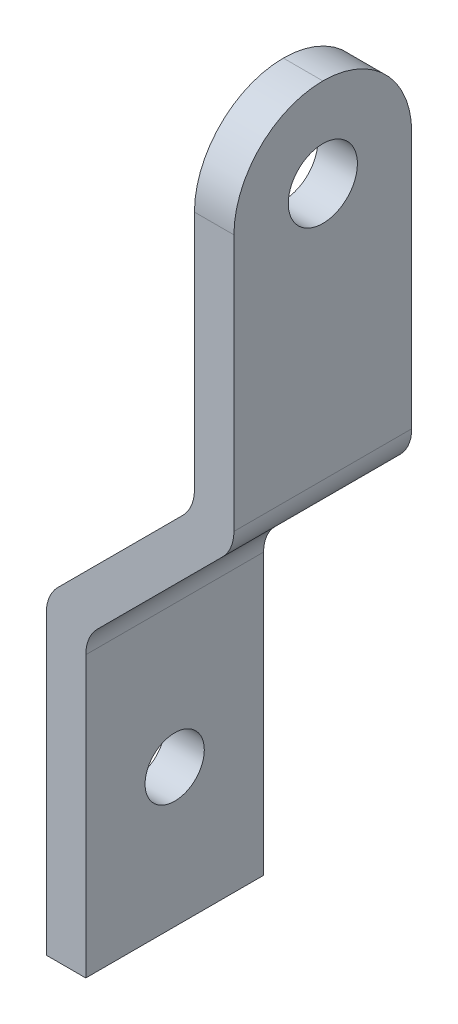
from build123d import *

# Parameters (mm, degrees)
BOSS_EXTRUDE1_DEPTH = 11.43
FILLET1_R           = 5.715
SKETCH3_R           = 2.2225
SKETCH3_R_2         = 1.905
CUT_EXTRUDE1_DEPTH  = 12.7
FILLET2_R           = 2.54


with BuildPart() as part:
    # Sketch1 → Boss-Extrude1 (new body)
    with BuildSketch(Plane.XY):
        Polygon((0, 0), (0, 20.102102448), (9.525, 29.627102448), (9.525, 51.852102448), (12.065, 51.852102448), (12.065, 28.575), (2.54, 19.05), (2.54, 0), align=None)
    extrude(amount=BOSS_EXTRUDE1_DEPTH)

    # Fillet1
    fillet1_edges = [part.edges().sort_by_distance(p)[0] for p in [
        (10.795, 51.852102448, 0),
        (10.795, 51.852102448, 11.43),
    ]]
    fillet(fillet1_edges, radius=FILLET1_R - 0.0001)  # a hair under: the kernel refuses the full size

    # Sketch3 → Cut-Extrude1 (cut)
    with BuildSketch(Plane(origin=(12.065, 0, 0), x_dir=(0, 0, -1), z_dir=(1, 0, 0))):
        with Locations(Location((-5.715, 46.137102448, 0), (0, 0, 90))):
            Circle(SKETCH3_R)
        with Locations((-5.715, 8.89)):
            Circle(SKETCH3_R_2)
    extrude(amount=-CUT_EXTRUDE1_DEPTH, mode=Mode.SUBTRACT)

    # Fillet2
    fillet2_edges = [part.edges().sort_by_distance(p)[0] for p in [
        (0, 20.102102448, 5.715),
        (9.525, 29.627102448, 5.715),
        (12.065, 28.575, 5.715),
        (2.54, 19.05, 5.715),
    ]]
    fillet(fillet2_edges, radius=FILLET2_R)


solid = part.part
